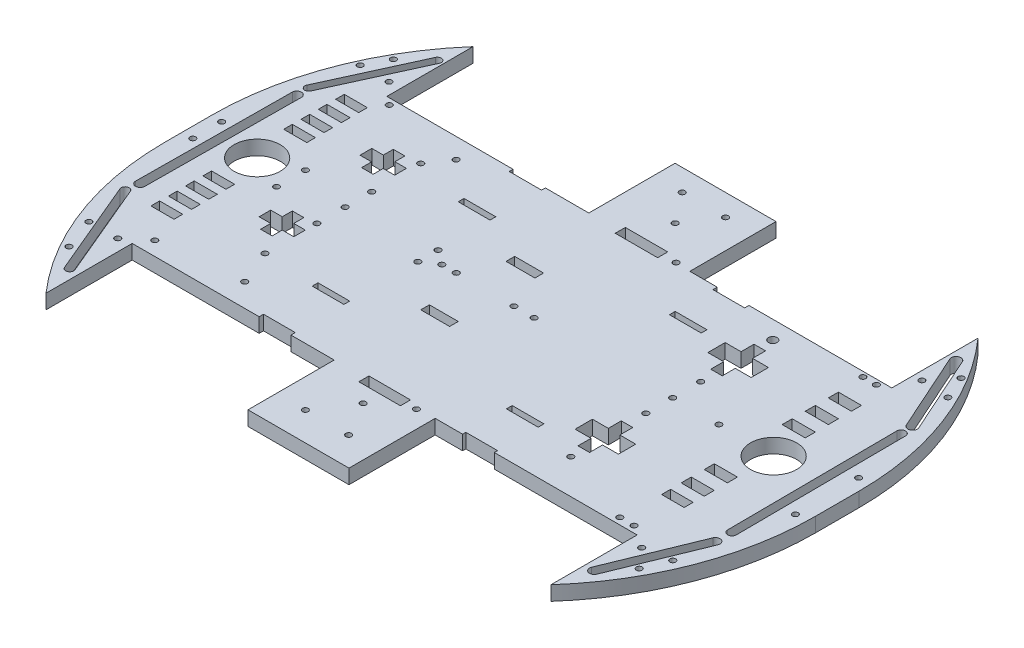
from build123d import *

# Parameters (mm, degrees)
SKETCH1_W           = 225
SKETCH1_H           = 148
BOSS_EXTRUDE1_DEPTH = 5
SKETCH2_W           = 70
SKETCH2_H           = 30
CUT_EXTRUDE4_DEPTH  = 5
FILLET3_R           = 100
FILLET4_R           = 100
FILLET5_R           = 100
FILLET6_R           = 100
CUT_EXTRUDE5_DEPTH  = 5
SKETCH4_R           = 1
CUT_EXTRUDE6_DEPTH  = 5
SKETCH5_R           = 1
CUT_EXTRUDE7_DEPTH  = 5
SKETCH6_W           = 11
SKETCH6_H           = 4.4525397
SKETCH6_R           = 8
SKETCH6_W_2         = 8
SKETCH6_H_2         = 3
SKETCH6_W_3         = 4
SKETCH6_H_3         = 4
SKETCH6_H_4         = 3.5
SKETCH6_R_2         = 1
SKETCH6_H_5         = 1.502060521
SKETCH6_H_6         = 2
SKETCH6_W_4         = 10
SKETCH6_W_5         = 14.699886656
SKETCH6_W_6         = 5.5
SKETCH6_H_7         = 6
SKETCH6_H_8         = 4.5
SKETCH6_R_3         = 1.5
SKETCH6_W_7         = 14.405888924
SKETCH6_H_9         = 11
SKETCH6_W_8         = 12
SKETCH6_H_10        = 4.083123714
SKETCH6_H_11        = 5.75
CUT_EXTRUDE8_DEPTH  = 5
SKETCH7_W           = 7.804855732
SKETCH7_H           = 3.121942292
SKETCH7_W_2         = 11.192718596
SKETCH7_H_2         = 7.748805182
CUT_EXTRUDE9_DEPTH  = 5


with BuildPart() as part:
    # Sketch1 → Boss-Extrude1 (new body)
    with BuildSketch(Plane(origin=(0, 0, 0), x_dir=(1, 0, 0), z_dir=(0, 1, 0))):
        with Locations((-62.210459631, -45.874148814)):
            Rectangle(SKETCH1_W, SKETCH1_H)
    extrude(amount=BOSS_EXTRUDE1_DEPTH)

    # Sketch2 → Cut-Extrude4 (cut)
    with BuildSketch(Plane(origin=(0, 5, 0), x_dir=(1, 0, 0), z_dir=(0, 1, 0))):
        with Locations((-115, 13.25)):
            Rectangle(SKETCH2_W, SKETCH2_H)
        with Locations((-10, 13.25)):
            Rectangle(SKETCH2_W, SKETCH2_H)
        with Locations((-115, -105)):
            Rectangle(SKETCH2_W, SKETCH2_H)
        with Locations((-10, -105)):
            Rectangle(SKETCH2_W, SKETCH2_H)
    extrude(amount=-CUT_EXTRUDE4_DEPTH, mode=Mode.SUBTRACT)

    # Fillet3
    # the kernel refuses this fillet: 100 mm, written as the material it takes off along each edge
    with BuildSketch(Plane(origin=(50.289540369, -166.176623313, -28.125851186), x_dir=(0, 0, 1), z_dir=(0, 1, 0))) as fillet3_piece_1:
        with BuildLine():
            CenterArc((66.470649325, -100), FILLET3_R, 90, 41.659812296)
            Line((0, -25.289540369), (-1.329412987, -23.795331176))
            ThreePointArc((-1.329412987, -23.795331176), (-2, -12.644770184), (-2, 0))
            Line((-2, 0), (0, 2))
            Line((0, 2), (66.470649325, 2))
            Line((66.470649325, 2), (66.470649325, 0))
        make_face()
    extrude(amount=337.353246626, mode=Mode.SUBTRACT)

    # Fillet4
    # the kernel refuses this fillet: 100 mm, written as the material it takes off along each edge
    with BuildSketch(Plane(origin=(50.289540369, -166.176623313, 119.874148814), x_dir=(-1, 0, 0), z_dir=(0, 1, 0))) as fillet4_piece_1:
        with BuildLine():
            CenterArc((100, -66.470649325), FILLET4_R, 138.340187704, 41.659812296)
            Line((0, -66.470649325), (-2, -66.470649325))
            Line((-2, -66.470649325), (-2, 0))
            Line((-2, 0), (0, 2))
            ThreePointArc((0, 2), (12.644770184, 2), (23.795331176, 1.329412987))
            Line((23.795331176, 1.329412987), (25.289540369, 0))
        make_face()
    extrude(amount=337.353246626, mode=Mode.SUBTRACT)

    # Fillet5
    # the kernel refuses this fillet: 100 mm, written as the material it takes off along each edge
    with BuildSketch(Plane(origin=(-174.710459631, -164.535047768, 119.874148814), x_dir=(0, 0, -1), z_dir=(0, 1, 0))) as fillet5_piece_1:
        with BuildLine():
            CenterArc((65.814019107, -100), FILLET5_R, 90, 41.158186964)
            Line((0, -24.710459631), (-1.316280382, -23.204668824))
            ThreePointArc((-1.316280382, -23.204668824), (-2, -12.355229816), (-2, 0))
            Line((-2, 0), (0, 2))
            Line((0, 2), (65.814019107, 2))
            Line((65.814019107, 2), (65.814019107, 0))
        make_face()
    extrude(amount=334.070095536, mode=Mode.SUBTRACT)

    # Fillet6
    # the kernel refuses this fillet: 100 mm, written as the material it takes off along each edge
    with BuildSketch(Plane(origin=(-174.710459631, -164.535047768, -28.125851186), x_dir=(1, 0, 0), z_dir=(0, 1, 0))) as fillet6_piece_1:
        with BuildLine():
            CenterArc((100, -65.814019107), FILLET6_R, 138.841813036, 41.158186964)
            Line((0, -65.814019107), (-2, -65.814019107))
            Line((-2, -65.814019107), (-2, 0))
            Line((-2, 0), (0, 2))
            ThreePointArc((0, 2), (12.355229816, 2), (23.204668824, 1.316280382))
            Line((23.204668824, 1.316280382), (24.710459631, 0))
        make_face()
    extrude(amount=334.070095536, mode=Mode.SUBTRACT)

    # Sketch3 → Cut-Extrude5 (cut)
    with BuildSketch(Plane(origin=(0, 5, 0), x_dir=(1, 0, 0), z_dir=(0, 1, 0))):
        with BuildLine():
            Line((41.788725696, -13.774899826), (42.175180288, -72.773634159))
            ThreePointArc((42.175180288, -72.773634159), (40.674429756, -74.294174807), (39.153889108, -72.793424275))
            Line((39.153889108, -72.793424275), (38.767434516, -13.794689943))
            ThreePointArc((38.767434516, -13.794689943), (40.268185048, -12.274149295), (41.788725696, -13.774899826))
        make_face()
        with BuildLine():
            Line((41.959699701, -78.985975461), (29.785034145, -108.78647269))
            ThreePointArc((29.785034145, -108.78647269), (27.676246704, -109.671975688), (26.790743706, -107.563188247))
            Line((26.790743706, -107.563188247), (38.965409261, -77.762691017))
            ThreePointArc((38.965409261, -77.762691017), (41.074196703, -76.877188019), (41.959699701, -78.985975461))
        make_face()
        with BuildLine():
            Line((38.646753895, -10.355819998), (26.36500205, 17.014941256))
            ThreePointArc((26.36500205, 17.014941256), (27.188684706, 19.179502655), (29.353246105, 18.355819998))
            Line((29.353246105, 18.355819998), (41.63499795, -9.014941256))
            ThreePointArc((41.63499795, -9.014941256), (40.811315294, -11.179502655), (38.646753895, -10.355819998))
        make_face()
    extrude(amount=-CUT_EXTRUDE5_DEPTH, mode=Mode.SUBTRACT)

    # Sketch4 → Cut-Extrude6 (cut)
    with BuildSketch(Plane(origin=(0, 5, 0), x_dir=(1, 0, 0), z_dir=(0, 1, 0))):
        with Locations(Location((46.243028966, -34.49247657, 0), (0, 0, 270))):
            Circle(SKETCH4_R)
        with Locations(Location((46.243028966, -56.408206519, 0), (0, 0, 270))):
            Circle(SKETCH4_R)
    extrude(amount=-CUT_EXTRUDE6_DEPTH, mode=Mode.SUBTRACT)

    # Sketch5 → Cut-Extrude7 (cut)
    with BuildSketch(Plane(origin=(0, 5, 0), x_dir=(1, 0, 0), z_dir=(0, 1, 0))):
        with Locations(Location((16.724737721, -87.73430565, 0), (0, 0, 270))):
            Circle(SKETCH5_R)
        with Locations(Location((21.651174205, -87.720719082, 0), (0, 0, 270))):
            Circle(SKETCH5_R)
        with Locations(Location((29.605202656, -93.038390809, 0), (0, 0, 270))):
            Circle(SKETCH5_R)
        with Locations(Location((35.442540178, -99.731871168, 0), (0, 0, 270))):
            Circle(SKETCH5_R)
        with Locations(Location((38.829382735, -91.478996263, 0), (0, 0, 270))):
            Circle(SKETCH5_R)
        with Locations(Location((27.967130442, 5.710572549, 0), (0, 0, 270))):
            Circle(SKETCH5_R)
        with Locations(Location((34.047964356, 13.201454907, 0), (0, 0, 270))):
            Circle(SKETCH5_R)
        with Locations(Location((37.573085466, 5.093676354, 0), (0, 0, 270))):
            Circle(SKETCH5_R)
        with Locations(Location((16.70374565, -3.4746171, 0), (0, 0, 270))):
            Circle(SKETCH5_R)
        with Locations(Location((21.382636737, -3.485339523, 0), (0, 0, 270))):
            Circle(SKETCH5_R)
    extrude(amount=-CUT_EXTRUDE7_DEPTH, mode=Mode.SUBTRACT)

    # Sketch6 → Cut-Extrude8 (cut)
    with BuildSketch(Plane(origin=(0, 5, 0), x_dir=(1, 0, 0), z_dir=(0, 1, 0))):
        with Locations((-100.5, 0.47626985)):
            Rectangle(SKETCH6_W, SKETCH6_H)
        with Locations(Location((-154, -42.7, 0), (0, 0, 270))):
            Circle(SKETCH6_R)
        with Locations((-154, -56)):
            Rectangle(SKETCH6_W_2, SKETCH6_H_2)
        with Locations((-154, -62)):
            Rectangle(SKETCH6_W_2, SKETCH6_H_2)
        with Locations((-153.923949914, -68)):
            Rectangle(SKETCH6_W_2, SKETCH6_H_2)
        with Locations((-154, -74)):
            Rectangle(SKETCH6_W_2, SKETCH6_H_2)
        with Locations((-134, -58)):
            Rectangle(SKETCH6_W_3, SKETCH6_H_3)
        with Locations((-130, -54.25)):
            Rectangle(SKETCH6_W_3, SKETCH6_H_4)
        with Locations((-130, -58)):
            Rectangle(SKETCH6_W_3, SKETCH6_H_3)
        with Locations((-126, -58)):
            Rectangle(SKETCH6_W_3, SKETCH6_H_3)
        with Locations((-130, -61.75)):
            Rectangle(SKETCH6_W_3, SKETCH6_H_4)
        with Locations(Location((-124, -52, 0), (0, 0, 270))):
            Circle(SKETCH6_R_2)
        with Locations((-100.5, -89.24896974)):
            Rectangle(SKETCH6_W, SKETCH6_H_5)
        with Locations((-100.5, -70.625867031)):
            Rectangle(SKETCH6_W, SKETCH6_H_6)
        with Locations((-100.5, -20)):
            Rectangle(SKETCH6_W, SKETCH6_H_6)
        with Locations((-75.070611174, -58.427851822)):
            Rectangle(SKETCH6_W_4, SKETCH6_H_2)
        with Locations((-62, -1.5)):
            Rectangle(SKETCH6_W_5, SKETCH6_H_4)
        with Locations((-30, -17.310513175)):
            Rectangle(SKETCH6_W, SKETCH6_H_6)
        with Locations((-14.75, -20)):
            Rectangle(SKETCH6_W_6, SKETCH6_H_7)
        with Locations((-10, -14.75)):
            Rectangle(SKETCH6_W_3, SKETCH6_H_8)
        with Locations((-5.25, -20)):
            Rectangle(SKETCH6_W_6, SKETCH6_H_7)
        with Locations((-10, -20)):
            Rectangle(SKETCH6_W_3, SKETCH6_H_7)
        with Locations((-10, -25.25)):
            Rectangle(SKETCH6_W_3, SKETCH6_H_8)
        with Locations(Location((-10, -8, 0), (0, 0, 270))):
            Circle(SKETCH6_R_3)
        with Locations(Location((25, -42.7, 0), (0, 0, 270))):
            Circle(SKETCH6_R)
        with Locations((21, -30)):
            Rectangle(SKETCH6_W_2, SKETCH6_H_4)
        with Locations((21, -22)):
            Rectangle(SKETCH6_W_2, SKETCH6_H_4)
        with Locations((21, -14)):
            Rectangle(SKETCH6_W_2, SKETCH6_H_4)
        with Locations((21, -57)):
            Rectangle(SKETCH6_W_2, SKETCH6_H_4)
        with Locations((21, -65)):
            Rectangle(SKETCH6_W_2, SKETCH6_H_4)
        with Locations((-10, -60.75)):
            Rectangle(SKETCH6_W_3, SKETCH6_H_8)
        with Locations((-5.25, -66)):
            Rectangle(SKETCH6_W_6, SKETCH6_H_7)
        with Locations((-14.75, -66)):
            Rectangle(SKETCH6_W_6, SKETCH6_H_7)
        with Locations((-10, -66)):
            Rectangle(SKETCH6_W_3, SKETCH6_H_7)
        with Locations((-10, -71.25)):
            Rectangle(SKETCH6_W_3, SKETCH6_H_8)
        with Locations(Location((-10, -78, 0), (0, 0, 270))):
            Circle(SKETCH6_R_2)
        with Locations((-30, -73.810513175)):
            Rectangle(SKETCH6_W, SKETCH6_H_6)
        with Locations((-62, -90.5)):
            Rectangle(SKETCH6_W_7, SKETCH6_H_4)
        with Locations((-74.824239556, -29.108846206)):
            Rectangle(SKETCH6_W_4, SKETCH6_H_2)
        with Locations((-131, -22)):
            Rectangle(SKETCH6_W_3, SKETCH6_H_9)
        with BuildLine():
            Line((-167.262083046, -12.227407281), (-153.285564083, 18.393362248))
            ThreePointArc((-153.285564083, 18.393362248), (-151.500485104, 19.059575438), (-150.834271914, 17.274496459))
            Line((-150.834271914, 17.274496459), (-164.810790877, -13.346273071))
            ThreePointArc((-164.810790877, -13.346273071), (-166.595869857, -14.01248626), (-167.262083046, -12.227407281))
        make_face()
        with Locations(Location((-164, 3, 0), (0, 0, 270))):
            Circle(SKETCH6_R_2)
        with Locations(Location((-160, 10.5, 0), (0, 0, 270))):
            Circle(SKETCH6_R_2)
        with Locations(Location((-171, -38, 0), (0, 0, 270))):
            Circle(SKETCH6_R_2)
        with Locations((-154, -28)):
            Rectangle(SKETCH6_W_2, SKETCH6_H_2)
        with Locations((-154, -22)):
            Rectangle(SKETCH6_W_2, SKETCH6_H_2)
        with Locations((-154, -16)):
            Rectangle(SKETCH6_W_2, SKETCH6_H_2)
        with Locations((-154, -10)):
            Rectangle(SKETCH6_W_2, SKETCH6_H_2)
        with Locations(Location((-154, 3, 0), (0, 0, 270))):
            Circle(SKETCH6_R_2)
        with Locations(Location((-147, -3.921965519, 0), (0, 0, 270))):
            Circle(SKETCH6_R_2)
        with Locations((-131, -22)):
            Rectangle(SKETCH6_W_8, SKETCH6_H_10)
        with BuildLine():
            Line((-164.933910922, -70.720964344), (-164.500776236, -16.867885068))
            ThreePointArc((-164.500776236, -16.867885068), (-166.07836505, -15.264713733), (-167.681536385, -16.842302547))
            Line((-167.681536385, -16.842302547), (-168.11467107, -70.695381823))
            ThreePointArc((-168.11467107, -70.695381823), (-166.537082257, -72.298553157), (-164.933910922, -70.720964344))
        make_face()
        with Locations(Location((-171, -48, 0), (0, 0, 270))):
            Circle(SKETCH6_R_2)
        with BuildLine():
            Line((-165.973288167, -74.647958021), (-151.994039434, -107.849615828))
            ThreePointArc((-151.994039434, -107.849615828), (-152.730993257, -109.658449951), (-154.53982738, -108.921496128))
            Line((-154.53982738, -108.921496128), (-168.519076112, -75.71983832))
            ThreePointArc((-168.519076112, -75.71983832), (-167.782122289, -73.911004198), (-165.973288167, -74.647958021))
        make_face()
        with Locations(Location((-164, -91, 0), (0, 0, 270))):
            Circle(SKETCH6_R_2)
        with Locations(Location((-160, -101.908327847, 0), (0, 0, 270))):
            Circle(SKETCH6_R_2)
        with Locations(Location((-147, -85.175490286, 0), (0, 0, 270))):
            Circle(SKETCH6_R_2)
        with Locations(Location((-154, -91, 0), (0, 0, 270))):
            Circle(SKETCH6_R_2)
        with Locations(Location((-124, -70, 0), (0, 0, 270))):
            Circle(SKETCH6_R_2)
        with Locations(Location((-119, -82, 0), (0, 0, 270))):
            Circle(SKETCH6_R_2)
        with Locations(Location((-119, -8.743291596, 0), (0, 0, 270))):
            Circle(SKETCH6_R_2)
        with Locations(Location((-124, -16, 0), (0, 0, 270))):
            Circle(SKETCH6_R_2)
        with Locations(Location((-142, -38, 0), (0, 0, 270))):
            Circle(SKETCH6_R_2)
        with Locations(Location((-142, -48, 0), (0, 0, 270))):
            Circle(SKETCH6_R_2)
        with Locations(Location((-124, -42.2, 0), (0, 0, 270))):
            Circle(SKETCH6_R_2)
        with Locations(Location((-124, -33, 0), (0, 0, 270))):
            Circle(SKETCH6_R_2)
        with Locations(Location((-95, -39, 0), (0, 0, 270))):
            Circle(SKETCH6_R_2)
        with Locations(Location((-95, -46, 0), (0, 0, 270))):
            Circle(SKETCH6_R_2)
        with Locations(Location((-90, -42.7, 0), (0, 0, 270))):
            Circle(SKETCH6_R_2)
        with Locations(Location((-85, -42.7, 0), (0, 0, 270))):
            Circle(SKETCH6_R_2)
        with Locations(Location((-65, -42.7, 0), (0, 0, 270))):
            Circle(SKETCH6_R_2)
        with Locations(Location((-58, -42.7, 0), (0, 0, 270))):
            Circle(SKETCH6_R_2)
        with Locations(Location((-50, -1.5, 0), (0, 0, 270))):
            Circle(SKETCH6_R_2)
        with Locations(Location((-70, 20.608474579, 0), (0, 0, 270))):
            Circle(SKETCH6_R_2)
        with Locations(Location((-55, 20.608474579, 0), (0, 0, 270))):
            Circle(SKETCH6_R_2)
        with Locations(Location((-62, 10.172307687, 0), (0, 0, 270))):
            Circle(SKETCH6_R_2)
        with Locations((-30, -0.355497447)):
            Rectangle(SKETCH6_W, SKETCH6_H_11)
        with Locations(Location((-10, -33, 0), (0, 0, 270))):
            Circle(SKETCH6_R_2)
        with Locations(Location((-10, -42.7, 0), (0, 0, 270))):
            Circle(SKETCH6_R_2)
        with Locations(Location((-10, -52, 0), (0, 0, 270))):
            Circle(SKETCH6_R_2)
        with Locations(Location((6, -42.7, 0), (0, 0, 270))):
            Circle(SKETCH6_R_2)
        with Locations(Location((-62, -97.98433101, 0), (0, 0, 270))):
            Circle(SKETCH6_R_2)
        with Locations(Location((-70, -110, 0), (0, 0, 270))):
            Circle(SKETCH6_R_2)
        with Locations(Location((-55, -110, 0), (0, 0, 270))):
            Circle(SKETCH6_R_2)
        with Locations(Location((-51.02407488, -90.5, 0), (0, 0, 270))):
            Circle(SKETCH6_R_2)
        with Locations((-30, -91.122731053)):
            Rectangle(SKETCH6_W, SKETCH6_H_8)
    extrude(amount=-CUT_EXTRUDE8_DEPTH, mode=Mode.SUBTRACT)

    # Sketch7 → Cut-Extrude9 (cut)
    with BuildSketch(Plane(origin=(0, 5, 0), x_dir=(1, 0, 0), z_dir=(0, 1, 0))):
        with Locations((21, -72.063869607)):
            Rectangle(SKETCH7_W, SKETCH7_H)
        with Locations((-100.658869415, 0.797434755)):
            Rectangle(SKETCH7_W_2, SKETCH7_H_2)
    extrude(amount=-CUT_EXTRUDE9_DEPTH, mode=Mode.SUBTRACT)


solid = part.part
